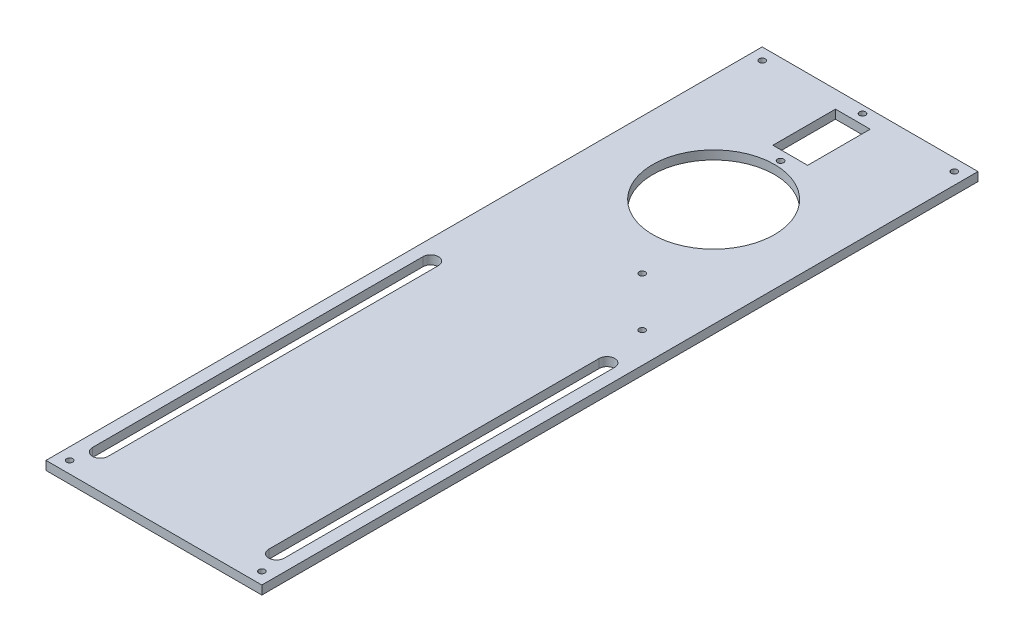
from build123d import *

# Parameters (mm, degrees)
SKETCH2_W           = 78.8444702
SKETCH2_H           = 3.2004
BOSS_EXTRUDE1_DEPTH = 261.62
SKETCH3_R           = 22.225
SKETCH3_R_2         = 1.1303
SKETCH3_W           = 12.7
SKETCH3_H           = 22.86
CUT_EXTRUDE1_DEPTH  = 266.388525487


with BuildPart() as part:
    # Sketch2 → Boss-Extrude1 (new body)
    with BuildSketch(Plane.XY):
        with Locations((-5.0277649, -1.6002)):
            Rectangle(SKETCH2_W, SKETCH2_H)
    extrude(amount=BOSS_EXTRUDE1_DEPTH)

    # Sketch3 → Cut-Extrude1 (cut, through all)
    with BuildSketch(Plane.XZ.offset(3.2004)):
        with Locations((-5.0277649, 57.15)):
            Circle(SKETCH3_R)
        with Locations((-40.132, 257.302)):
            Circle(SKETCH3_R_2)
        with Locations((30.0764702, 257.302)):
            Circle(SKETCH3_R_2)
        with Locations((-40.132, 4.318)):
            Circle(SKETCH3_R_2)
        with Locations((30.0764702, 4.318)):
            Circle(SKETCH3_R_2)
        with Locations((-5.0277649, 32.686487591)):
            Circle(SKETCH3_R_2)
        with Locations((-5.0277649, 2.765287591)):
            Circle(SKETCH3_R_2)
        with Locations((5.313199751, 93.618509551)):
            Circle(SKETCH3_R_2)
        with Locations((23.2108502, 111.51616)):
            Circle(SKETCH3_R_2)
        with BuildLine():
            Line((-40.053517537, 128.317412284), (-40.053517537, 249.024041398))
            ThreePointArc((-40.053517537, 249.024041398), (-37.219693042, 251.857865893), (-34.385868547, 249.024041398))
            Line((-34.385868547, 249.024041398), (-34.385868547, 128.317412284))
            ThreePointArc((-34.385868547, 128.317412284), (-37.219693042, 125.483587789), (-40.053517537, 128.317412284))
        make_face()
        with BuildLine():
            Line((24.330338747, 128.317412284), (24.330338747, 249.024041398))
            ThreePointArc((24.330338747, 249.024041398), (27.164163242, 251.857865893), (29.997987737, 249.024041398))
            Line((29.997987737, 249.024041398), (29.997987737, 128.317412284))
            ThreePointArc((29.997987737, 128.317412284), (27.164163242, 125.483587789), (24.330338747, 128.317412284))
        make_face()
        with Locations((-5.0277649, 17.725887591)):
            Rectangle(SKETCH3_W, SKETCH3_H)
    extrude(amount=-CUT_EXTRUDE1_DEPTH, mode=Mode.SUBTRACT)


solid = part.part
